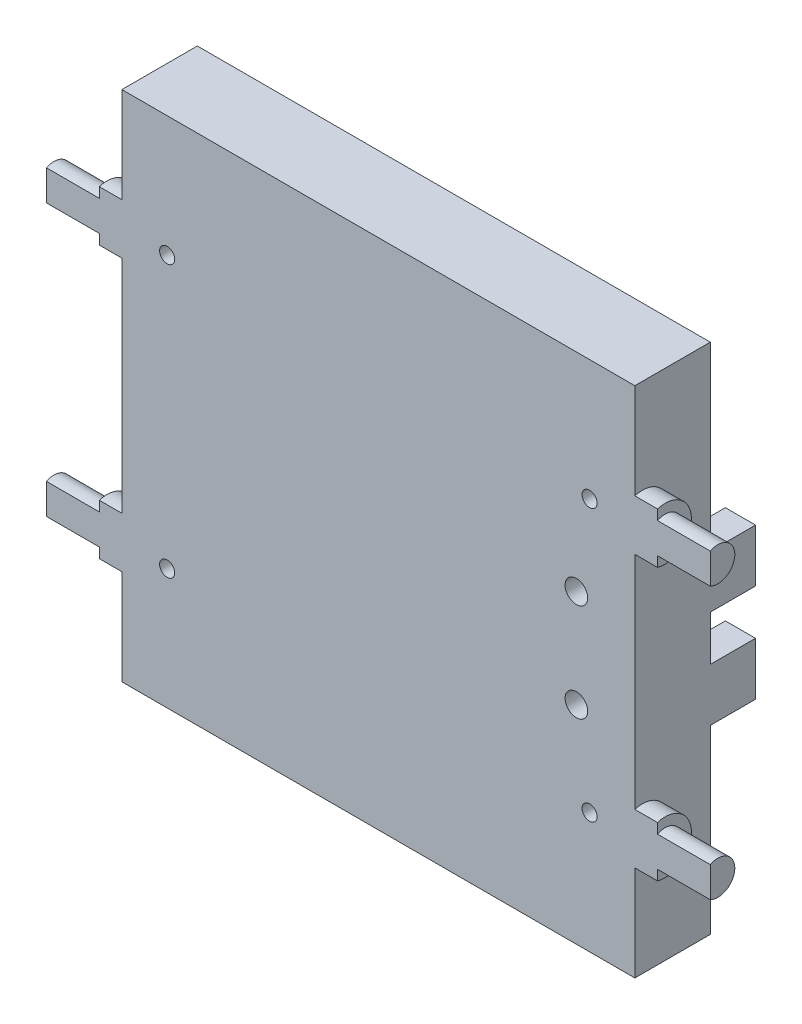
from build123d import *

# Parameters (mm, degrees)
SKETCH1_W           = 68
SKETCH1_H           = 68
BOSS_EXTRUDE1_DEPTH = 10
BOSS_EXTRUDE2_DEPTH = 3
BOSS_EXTRUDE3_DEPTH = 7
BOSS_EXTRUDE4_START = 3
BOSS_EXTRUDE4_DEPTH = 3
BOSS_EXTRUDE5_START = 7
BOSS_EXTRUDE5_DEPTH = 7
SKETCH6_W           = 42.5
SKETCH6_H           = 42.5
CUT_EXTRUDE1_DEPTH  = 3
SKETCH8_R           = 1.5
CUT_EXTRUDE2_DEPTH  = 5
SKETCH9_W           = 4
SKETCH9_H           = 7
BOSS_EXTRUDE6_DEPTH = 6
SKETCH10_R          = 1.5
CUT_EXTRUDE3_DEPTH  = 10
SKETCH11_R          = 1
CUT_EXTRUDE4_DEPTH  = 20


with BuildPart() as part:
    # Sketch1 → Boss-Extrude1 (new body)
    with BuildSketch(Plane.XY):
        with Locations((-34, -34)):
            Rectangle(SKETCH1_W, SKETCH1_H)
    extrude(amount=BOSS_EXTRUDE1_DEPTH)

    # Sketch2 → Boss-Extrude2 (add)
    with BuildSketch(Plane.ZY.offset(68)):
        with BuildLine():
            Line((10, -55.354101966), (10, -48.645898034))
            ThreePointArc((10, -48.645898034), (5.5, -52), (10, -55.354101966))
        make_face()
        with BuildLine():
            Line((10, -19.354101966), (10, -12.645898034))
            ThreePointArc((10, -12.645898034), (5.5, -16), (10, -19.354101966))
        make_face()
    extrude(amount=BOSS_EXTRUDE2_DEPTH)

    # Sketch3 → Boss-Extrude3 (add)
    with BuildSketch(Plane.ZY.offset(71)):
        with BuildLine():
            ThreePointArc((10, -49.984435563), (6.75, -52), (10, -54.015564437))
            Line((10, -54.015564437), (10, -49.984435563))
        make_face()
        with BuildLine():
            ThreePointArc((10, -13.984435563), (6.75, -16), (10, -18.015564437))
            Line((10, -18.015564437), (10, -13.984435563))
        make_face()
    extrude(amount=BOSS_EXTRUDE3_DEPTH)

    # Sketch4 → Boss-Extrude4 (add)
    with BuildSketch(Plane(origin=(0, 0, 0), x_dir=(0, 0, -1), z_dir=(1, 0, 0)).offset(BOSS_EXTRUDE4_START)):
        with BuildLine():
            ThreePointArc((-10, -19.354101966), (-5.5, -16), (-10, -12.645898034))
            Line((-10, -12.645898034), (-10, -19.354101966))
        make_face()
        with BuildLine():
            ThreePointArc((-10, -55.354101966), (-5.5, -52), (-10, -48.645898034))
            Line((-10, -48.645898034), (-10, -55.354101966))
        make_face()
    extrude(amount=-BOSS_EXTRUDE4_DEPTH)

    # Sketch5 → Boss-Extrude5 (add)
    with BuildSketch(Plane(origin=(3, 0, 0), x_dir=(0, 0, -1), z_dir=(1, 0, 0)).offset(BOSS_EXTRUDE5_START)):
        with BuildLine():
            ThreePointArc((-10, -18.015564437), (-6.75, -16), (-10, -13.984435563))
            Line((-10, -13.984435563), (-10, -18.015564437))
        make_face()
        with BuildLine():
            ThreePointArc((-10, -54.015564437), (-6.75, -52), (-10, -49.984435563))
            Line((-10, -49.984435563), (-10, -54.015564437))
        make_face()
    extrude(amount=-BOSS_EXTRUDE5_DEPTH)

    # Sketch6 → Cut-Extrude1 (cut)
    with BuildSketch(Plane(origin=(0, 0, 0), x_dir=(-1, 0, 0), z_dir=(0, 0, -1))):
        with Locations((34, -34)):
            Rectangle(SKETCH6_W, SKETCH6_H)
    extrude(amount=-CUT_EXTRUDE1_DEPTH, mode=Mode.SUBTRACT)

    # Sketch8 → Cut-Extrude2 (cut)
    with BuildSketch(Plane(origin=(0, 0, 0), x_dir=(-1, 0, 0), z_dir=(0, 0, -1))):
        with Locations((20.75, -7.75)):
            Circle(SKETCH8_R)
        with Locations((47.25, -7.75)):
            Circle(SKETCH8_R)
        with Locations((47.25, -60.25)):
            Circle(SKETCH8_R)
        with Locations((20.75, -60.25)):
            Circle(SKETCH8_R)
    extrude(amount=-CUT_EXTRUDE2_DEPTH, mode=Mode.SUBTRACT)

    # Sketch9 → Boss-Extrude6 (add)
    with BuildSketch(Plane(origin=(0, 0, 0), x_dir=(-1, 0, 0), z_dir=(0, 0, -1))):
        with Locations((2, -27.5)):
            Rectangle(SKETCH9_W, SKETCH9_H)
        with Locations((2, -40.5)):
            Rectangle(SKETCH9_W, SKETCH9_H)
    extrude(amount=BOSS_EXTRUDE6_DEPTH)

    # Sketch10 → Cut-Extrude3 (cut)
    with BuildSketch(Plane(origin=(0, 0, 0), x_dir=(-1, 0, 0), z_dir=(0, 0, -1))):
        with Locations((7.75, -27.5)):
            Circle(SKETCH10_R)
        with Locations((7.75, -40.5)):
            Circle(SKETCH10_R)
    extrude(amount=-CUT_EXTRUDE3_DEPTH, mode=Mode.SUBTRACT)

    # Sketch11 → Cut-Extrude4 (cut)
    with BuildSketch(Plane.XY.offset(10)):
        with Locations((-62, -52)):
            Circle(SKETCH11_R)
        with Locations((-62, -16)):
            Circle(SKETCH11_R)
        with Locations((-6, -52)):
            Circle(SKETCH11_R)
        with Locations((-6, -16)):
            Circle(SKETCH11_R)
    extrude(amount=-CUT_EXTRUDE4_DEPTH, mode=Mode.SUBTRACT)


solid = part.part
